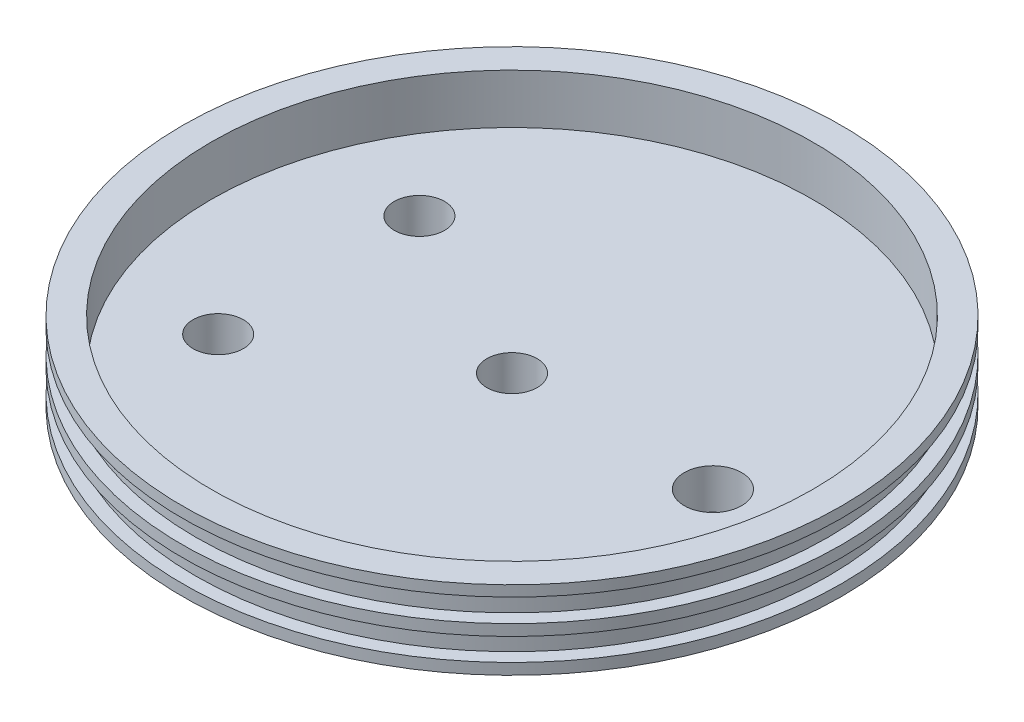
from build123d import *

# Parameters (mm, degrees)
SKETCH6_R                                = 66.04
BOSS_EXTRUDE1_DEPTH                      = 2.54
PIPE_TAP_DRILL_FOR_1_4_TAP_GN2_D         = 11.1252
SKETCH7_R                                = 6.35
CUT_EXTRUDE1_SIPHON_DEPTH                = 105.994177492
PIPE_TAP_DRILL_FOR_1_4_TAP_RELIEF_VALV_D = 11.1252
PIPE_TAP_DRILL_FOR_1_4_TAP_VENT_VALVE_D  = 11.1252


with BuildPart() as part:
    # Sketch1 → Revolve1 (revolve)
    with BuildSketch(Plane.XY):
        Polygon((0, 0), (72.898, 0), (72.898, 2.4638), (69.977, 2.4638), (69.977, 7.4422), (72.898, 7.4422), (72.898, 9.906), (69.977, 9.906), (69.977, 14.986), (72.898, 14.986), (72.898, 17.3482), (66.548, 17.3482), (66.548, 6.35), (0, 6.35), align=None)
    revolve(axis=Axis((0, 48.192213231, 0), (0, -1, 0)))

    # Sketch6 → Boss-Extrude1 (add)
    with BuildSketch(Plane.XZ):
        Circle(SKETCH6_R)
    extrude(amount=BOSS_EXTRUDE1_DEPTH)

    # Pipe Tap Drill for 1/4 Tap - GN2 (through all)
    with Locations(Plane(origin=(0, 6.35, 0), x_dir=(1, 0, 0), z_dir=(0, 1, 0))):
        with Locations((0, 0)):
            Hole(PIPE_TAP_DRILL_FOR_1_4_TAP_GN2_D / 2)

    # Sketch7 → Cut-Extrude1-Siphon (cut, through all)
    with BuildSketch(Plane(origin=(0, -2.54, 0), x_dir=(-1, 0, 0), z_dir=(0, -1, 0))):
        with Locations((-44.45, 0)):
            Circle(SKETCH7_R)
    extrude(amount=-CUT_EXTRUDE1_SIPHON_DEPTH, mode=Mode.SUBTRACT)

    # Pipe Tap Drill for 1/4 Tap - Relief Valve (through all)
    with Locations(Plane(origin=(0, -2.54, 0), x_dir=(-1, 0, 0), z_dir=(0, -1, 0))):
        with Locations((40.358041229, 19.878625199)):
            Hole(PIPE_TAP_DRILL_FOR_1_4_TAP_RELIEF_VALV_D / 2)

    # Pipe Tap Drill for 1/4 Tap - Vent Valve (through all)
    with Locations(Plane(origin=(0, -2.54, 0), x_dir=(-1, 0, 0), z_dir=(0, -1, 0))):
        with Locations((39.961427255, -25.031151171)):
            Hole(PIPE_TAP_DRILL_FOR_1_4_TAP_VENT_VALVE_D / 2)


solid = part.part
